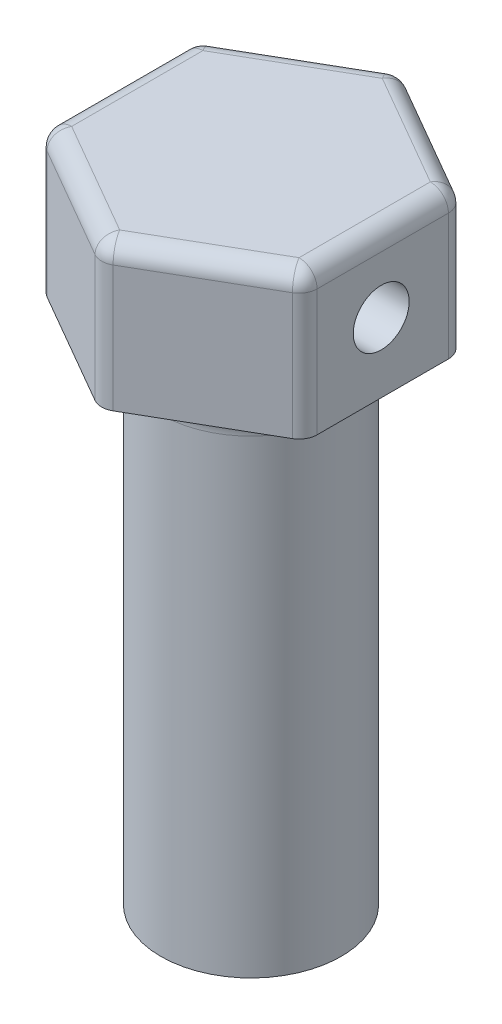
from build123d import *

# Parameters (mm, degrees)
BOSS_EXTRUDE1_DEPTH = 8
SKETCH2_R           = 5
BOSS_EXTRUDE2_DEPTH = 28
FILLET1_R           = 2
SKETCH3_R           = 1.55
CUT_EXTRUDE1_DEPTH  = 33.683533061
FILLET2_R           = 1
CUT_EXTRUDE3_START  = -4
SKETCH5_R           = 2.05
CUT_EXTRUDE3_DEPTH  = 4


with BuildPart() as part:
    # Sketch1 → Boss-Extrude1 (new body)
    with BuildSketch(Plane(origin=(0, 0, 0), x_dir=(1, 0, 0), z_dir=(0, 1, 0))):
        Polygon((7.3, -4.214656965), (7.3, 4.214656965), (0, 8.42931393), (-7.3, 4.214656965), (-7.3, -4.214656965), (0, -8.42931393), align=None)
    extrude(amount=BOSS_EXTRUDE1_DEPTH)

    # Sketch2 → Boss-Extrude2 (add)
    with BuildSketch(Plane.XZ):
        Circle(SKETCH2_R)
        with BuildLine():
            Line((-1.55, 1.341640786), (-1.55, -1.341640786))
            ThreePointArc((-1.55, -1.341640786), (2.05, 0), (-1.55, 1.341640786))
        make_face(mode=Mode.SUBTRACT)
    extrude(amount=BOSS_EXTRUDE2_DEPTH)

    # Fillet1
    fillet1_edges = [part.edges().sort_by_distance(p)[0] for p in [
        (-5, 0, 0),
    ]]
    fillet(fillet1_edges, radius=FILLET1_R)

    # Sketch3 → Cut-Extrude1 (cut, through all)
    with BuildSketch(Plane(origin=(7.3, 0, 0), x_dir=(0, 0, -1), z_dir=(1, 0, 0))):
        with Locations((-0.085343035, 3.85)):
            Circle(SKETCH3_R)
    extrude(amount=-CUT_EXTRUDE1_DEPTH, mode=Mode.SUBTRACT)

    # Fillet2
    fillet2_edges = [part.edges().sort_by_distance(p)[0] for p in [
        (-3.65, 8, 6.321985448),
        (-7.3, 8, 0),
        (-3.65, 8, -6.321985448),
        (3.65, 8, -6.321985448),
        (7.3, 8, 0),
        (3.65, 8, 6.321985448),
        (-7.3, 4, -4.214656965),
        (0, 4, -8.42931393),
        (7.3, 4, -4.214656965),
        (7.3, 4, 4.214656965),
        (0, 4, 8.42931393),
        (-7.3, 4, 4.214656965),
    ]]
    fillet(fillet2_edges, radius=FILLET2_R)

    # Sketch5 → Cut-Extrude3 (cut)
    with BuildSketch(Plane.XZ.offset(28).offset(CUT_EXTRUDE3_START)):
        Circle(SKETCH5_R)
    extrude(amount=CUT_EXTRUDE3_DEPTH, mode=Mode.SUBTRACT)


solid = part.part
